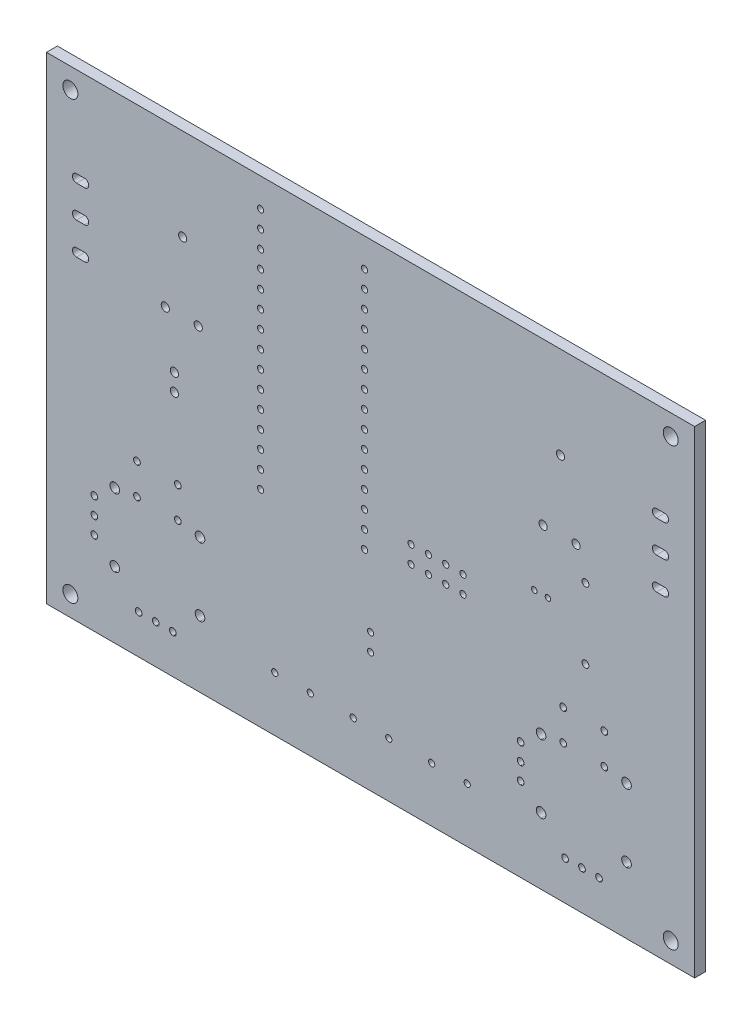
from build123d import *

# Parameters (mm, degrees)
SKETCH1_W           = 95.0000132
SKETCH1_H           = 70.0000124
SKETCH1_R           = 0.4572
SKETCH1_R_2         = 0.5999988
SKETCH1_R_3         = 0.499999
SKETCH1_R_4         = 0.4500118
SKETCH1_R_5         = 0.3999992
SKETCH1_R_6         = 1.0999978
BOSS_EXTRUDE1_DEPTH = 0.8
CUT_EXTRUDE1_START  = -1.6
CUT_EXTRUDE1_DEPTH  = 1.6


# Read off the part's stored shape, not the designer's step: Cut-Extrude1
with BuildPart() as part:
    # Sketch1 → Boss-Extrude1 (new, symmetric)
    with BuildSketch(Plane.XY):
        with Locations((47.5000066, 35.0000062)):
            Rectangle(SKETCH1_W, SKETCH1_H)
        with Locations((31.3800236, 60.7000056)):
            Circle(SKETCH1_R, mode=Mode.SUBTRACT)
        with Locations((31.3800236, 58.1600056)):
            Circle(SKETCH1_R, mode=Mode.SUBTRACT)
        with Locations((17.4200058, 46.3799936)):
            Circle(SKETCH1_R_2, mode=Mode.SUBTRACT)
        with Locations((19.9600058, 56.5399936)):
            Circle(SKETCH1_R_2, mode=Mode.SUBTRACT)
        with Locations((22.2460058, 46.3799936)):
            Circle(SKETCH1_R_2, mode=Mode.SUBTRACT)
        with Locations((79.00035, 42.150411)):
            Circle(SKETCH1_R_3, mode=Mode.SUBTRACT)
        with Locations((79.00035, 31.8504062)):
            Circle(SKETCH1_R_3, mode=Mode.SUBTRACT)
        with Locations((72.795003, 46.3799936)):
            Circle(SKETCH1_R_2, mode=Mode.SUBTRACT)
        with Locations((75.335003, 56.5399936)):
            Circle(SKETCH1_R_2, mode=Mode.SUBTRACT)
        with Locations((77.621003, 46.3799936)):
            Circle(SKETCH1_R_2, mode=Mode.SUBTRACT)
        with Locations((47.4980254, 20.142962)):
            Circle(SKETCH1_R_4, mode=Mode.SUBTRACT)
        with Locations((47.4980254, 17.602962)):
            Circle(SKETCH1_R_4, mode=Mode.SUBTRACT)
        with Locations((18.7500006, 36.2300012)):
            Circle(SKETCH1_R_2, mode=Mode.SUBTRACT)
        with Locations((33.4600042, 8.0000094)):
            Circle(SKETCH1_R, mode=Mode.SUBTRACT)
        with Locations((38.6670042, 8.0000094)):
            Circle(SKETCH1_R, mode=Mode.SUBTRACT)
        with Locations((44.9599558, 8.0000094)):
            Circle(SKETCH1_R, mode=Mode.SUBTRACT)
        with Locations((50.1669558, 8.0000094)):
            Circle(SKETCH1_R, mode=Mode.SUBTRACT)
        with Locations((56.460009, 8.0000094)):
            Circle(SKETCH1_R, mode=Mode.SUBTRACT)
        with Locations((61.667009, 8.0000094)):
            Circle(SKETCH1_R, mode=Mode.SUBTRACT)
        with Locations((71.5000094, 37.5000012)):
            Circle(SKETCH1_R_5, mode=Mode.SUBTRACT)
        with Locations((73.5000054, 37.5000012)):
            Circle(SKETCH1_R_5, mode=Mode.SUBTRACT)
        with Locations((46.6200236, 30.2200056)):
            Circle(SKETCH1_R, mode=Mode.SUBTRACT)
        with Locations((46.6200236, 32.7600056)):
            Circle(SKETCH1_R, mode=Mode.SUBTRACT)
        with Locations((46.6200236, 35.3000056)):
            Circle(SKETCH1_R, mode=Mode.SUBTRACT)
        with Locations((46.6200236, 37.8400056)):
            Circle(SKETCH1_R, mode=Mode.SUBTRACT)
        with Locations((46.6200236, 40.3800056)):
            Circle(SKETCH1_R, mode=Mode.SUBTRACT)
        with Locations((46.6200236, 42.9200056)):
            Circle(SKETCH1_R, mode=Mode.SUBTRACT)
        with Locations((46.6200236, 45.4600056)):
            Circle(SKETCH1_R, mode=Mode.SUBTRACT)
        with Locations((46.6200236, 48.0000056)):
            Circle(SKETCH1_R, mode=Mode.SUBTRACT)
        with Locations((46.6200236, 50.5400056)):
            Circle(SKETCH1_R, mode=Mode.SUBTRACT)
        with Locations((46.6200236, 53.0800056)):
            Circle(SKETCH1_R, mode=Mode.SUBTRACT)
        with Locations((46.6200236, 55.6200056)):
            Circle(SKETCH1_R, mode=Mode.SUBTRACT)
        with Locations((46.6200236, 58.1600056)):
            Circle(SKETCH1_R, mode=Mode.SUBTRACT)
        with Locations((46.6200236, 60.7000056)):
            Circle(SKETCH1_R, mode=Mode.SUBTRACT)
        with Locations((46.6200236, 63.2400056)):
            Circle(SKETCH1_R, mode=Mode.SUBTRACT)
        with Locations((46.6200236, 65.7800056)):
            Circle(SKETCH1_R, mode=Mode.SUBTRACT)
        with Locations((31.3800236, 65.7800056)):
            Circle(SKETCH1_R, mode=Mode.SUBTRACT)
        with Locations((31.3800236, 63.2400056)):
            Circle(SKETCH1_R, mode=Mode.SUBTRACT)
        with Locations((31.3800236, 55.6200056)):
            Circle(SKETCH1_R, mode=Mode.SUBTRACT)
        with Locations((31.3800236, 53.0800056)):
            Circle(SKETCH1_R, mode=Mode.SUBTRACT)
        with Locations((31.3800236, 50.5400056)):
            Circle(SKETCH1_R, mode=Mode.SUBTRACT)
        with Locations((31.3800236, 48.0000056)):
            Circle(SKETCH1_R, mode=Mode.SUBTRACT)
        with Locations((31.3800236, 45.4600056)):
            Circle(SKETCH1_R, mode=Mode.SUBTRACT)
        with Locations((31.3800236, 42.9200056)):
            Circle(SKETCH1_R, mode=Mode.SUBTRACT)
        with Locations((31.3800236, 40.3800056)):
            Circle(SKETCH1_R, mode=Mode.SUBTRACT)
        with Locations((31.3800236, 37.8400056)):
            Circle(SKETCH1_R, mode=Mode.SUBTRACT)
        with Locations((31.3800236, 35.3000056)):
            Circle(SKETCH1_R, mode=Mode.SUBTRACT)
        with Locations((31.3800236, 32.7600056)):
            Circle(SKETCH1_R, mode=Mode.SUBTRACT)
        with Locations((31.3800236, 30.2200056)):
            Circle(SKETCH1_R, mode=Mode.SUBTRACT)
        with Locations((55.9799998, 31.7300102)):
            Circle(SKETCH1_R, mode=Mode.SUBTRACT)
        with Locations((58.5199998, 31.7300102)):
            Circle(SKETCH1_R, mode=Mode.SUBTRACT)
        with Locations((61.0599998, 31.7300102)):
            Circle(SKETCH1_R, mode=Mode.SUBTRACT)
        with Locations((61.0599998, 34.2700102)):
            Circle(SKETCH1_R, mode=Mode.SUBTRACT)
        with Locations((58.5199998, 34.2700102)):
            Circle(SKETCH1_R, mode=Mode.SUBTRACT)
        with Locations((55.9799998, 34.2700102)):
            Circle(SKETCH1_R, mode=Mode.SUBTRACT)
        with Locations((53.4399998, 34.2700102)):
            Circle(SKETCH1_R, mode=Mode.SUBTRACT)
        with Locations((18.7500006, 38.7700012)):
            Circle(SKETCH1_R_2, mode=Mode.SUBTRACT)
        with Locations((53.4399998, 31.7300102)):
            Circle(SKETCH1_R, mode=Mode.SUBTRACT)
        with Locations((3.50012, 2.9999686)):
            Circle(SKETCH1_R_6, mode=Mode.SUBTRACT)
        with Locations((91.499944, 2.9999686)):
            Circle(SKETCH1_R_6, mode=Mode.SUBTRACT)
        with Locations((91.499944, 66.9998406)):
            Circle(SKETCH1_R_6, mode=Mode.SUBTRACT)
        with Locations((3.50012, 66.9998406)):
            Circle(SKETCH1_R_6, mode=Mode.SUBTRACT)
        with BuildLine():
            Line((5.6000142, 56.799988), (4.4000166, 56.799988))
            ThreePointArc((4.4000166, 56.799988), (3.8000178, 56.1999892), (4.4000166, 55.5999904))
            Line((4.4000166, 55.5999904), (5.6000142, 55.5999904))
            ThreePointArc((5.6000142, 55.5999904), (6.200013, 56.1999892), (5.6000142, 56.799988))
        make_face(mode=Mode.SUBTRACT)
        with BuildLine():
            Line((5.6000142, 52.0999974), (4.4000166, 52.0999974))
            ThreePointArc((4.4000166, 52.0999974), (3.8000178, 51.4999986), (4.4000166, 50.8999998))
            Line((4.4000166, 50.8999998), (5.6000142, 50.8999998))
            ThreePointArc((5.6000142, 50.8999998), (6.200013, 51.4999986), (5.6000142, 52.0999974))
        make_face(mode=Mode.SUBTRACT)
        with BuildLine():
            Line((5.6000142, 47.4000068), (4.4000166, 47.4000068))
            ThreePointArc((4.4000166, 47.4000068), (3.8000178, 46.800008), (4.4000166, 46.2000092))
            Line((4.4000166, 46.2000092), (5.6000142, 46.2000092))
            ThreePointArc((5.6000142, 46.2000092), (6.200013, 46.800008), (5.6000142, 47.4000068))
        make_face(mode=Mode.SUBTRACT)
        with BuildLine():
            Line((90.600022, 56.799988), (89.4000244, 56.799988))
            ThreePointArc((89.4000244, 56.799988), (88.8000256, 56.1999892), (89.4000244, 55.5999904))
            Line((89.4000244, 55.5999904), (90.600022, 55.5999904))
            ThreePointArc((90.600022, 55.5999904), (91.2000208, 56.1999892), (90.600022, 56.799988))
        make_face(mode=Mode.SUBTRACT)
        with BuildLine():
            Line((90.600022, 52.0999974), (89.4000244, 52.0999974))
            ThreePointArc((89.4000244, 52.0999974), (88.8000256, 51.4999986), (89.4000244, 50.8999998))
            Line((89.4000244, 50.8999998), (90.600022, 50.8999998))
            ThreePointArc((90.600022, 50.8999998), (91.2000208, 51.4999986), (90.600022, 52.0999974))
        make_face(mode=Mode.SUBTRACT)
        with BuildLine():
            Line((90.600022, 47.4000068), (89.4000244, 47.4000068))
            ThreePointArc((89.4000244, 47.4000068), (88.8000256, 46.800008), (89.4000244, 46.2000092))
            Line((89.4000244, 46.2000092), (90.600022, 46.2000092))
            ThreePointArc((90.600022, 46.2000092), (91.2000208, 46.800008), (90.600022, 47.4000068))
        make_face(mode=Mode.SUBTRACT)
    extrude(amount=BOSS_EXTRUDE1_DEPTH, both=True)

    # Cut-Extrude1 outline → Cut-Extrude1 (cut)
    with BuildSketch(Plane.XY.offset(0.8).offset(CUT_EXTRUDE1_START)):
        with BuildLine():
            add(Edge.make_bspline(
                [(10.018886736, 20.42583118), (10.40855395, 20.42583118), (10.724442291, 20.109948222), (10.724442291, 19.330603027), (10.40855395, 19.014720069), (10.018886736, 19.014720069)],
                knots=[0, 0, 0, 0, 1, 1, 2, 2, 2, 2], degree=3))
            add(Edge.make_bspline(
                [(10.018886736, 19.014720069), (9.629214138, 19.014720069), (9.31333118, 19.330603027), (9.31333118, 20.109948222), (9.629214138, 20.42583118), (10.018886736, 20.42583118)],
                knots=[2, 2, 2, 2, 3, 3, 4, 4, 4, 4], degree=3))
        make_face()
        with BuildLine():
            add(Edge.make_bspline(
                [(85.019444444, 10.442213609), (85.409111659, 10.442213609), (85.725, 10.126330651), (85.725, 9.346985457), (85.409111659, 9.031102498), (85.019444444, 9.031102498)],
                knots=[0, 0, 0, 0, 1, 1, 2, 2, 2, 2], degree=3))
            add(Edge.make_bspline(
                [(85.019444444, 9.031102498), (84.62977723, 9.031102498), (84.313888889, 9.346985457), (84.313888889, 10.126330651), (84.62977723, 10.442213609), (85.019444444, 10.442213609)],
                knots=[2, 2, 2, 2, 3, 3, 4, 4, 4, 4], degree=3))
        make_face()
        with BuildLine():
            add(Edge.make_bspline(
                [(85.019444444, 20.42583118), (85.409111659, 20.42583118), (85.725, 20.109948222), (85.725, 19.330603027), (85.409111659, 19.014720069), (85.019444444, 19.014720069)],
                knots=[0, 0, 0, 0, 1, 1, 2, 2, 2, 2], degree=3))
            add(Edge.make_bspline(
                [(85.019444444, 19.014720069), (84.62977723, 19.014720069), (84.313888889, 19.330603027), (84.313888889, 20.109948222), (84.62977723, 20.42583118), (85.019444444, 20.42583118)],
                knots=[2, 2, 2, 2, 3, 3, 4, 4, 4, 4], degree=3))
        make_face()
        with BuildLine():
            add(Edge.make_bspline(
                [(81.77388862, 20.708049096), (82.046655401, 20.708049096), (82.267778047, 20.486927795), (82.267778047, 19.941396925), (82.046655401, 19.720275625), (81.77388862, 19.720275625)],
                knots=[0, 0, 0, 0, 1, 1, 2, 2, 2, 2], degree=3))
            add(Edge.make_bspline(
                [(81.77388862, 19.720275625), (81.501121839, 19.720275625), (81.279999193, 19.941396925), (81.279999193, 20.486927795), (81.501121839, 20.708049096), (81.77388862, 20.708049096)],
                knots=[2, 2, 2, 2, 3, 3, 4, 4, 4, 4], degree=3))
        make_face()
        with BuildLine():
            add(Edge.make_bspline(
                [(75.741387812, 20.708049096), (76.014155939, 20.708049096), (76.235277239, 20.486927795), (76.235277239, 19.941396925), (76.014155939, 19.720275625), (75.741387812, 19.720275625)],
                knots=[0, 0, 0, 0, 1, 1, 2, 2, 2, 2], degree=3))
            add(Edge.make_bspline(
                [(75.741387812, 19.720275625), (75.468619686, 19.720275625), (75.247498385, 19.941396925), (75.247498385, 20.486927795), (75.468619686, 20.708049096), (75.741387812, 20.708049096)],
                knots=[2, 2, 2, 2, 3, 3, 4, 4, 4, 4], degree=3))
        make_face()
        with BuildLine():
            add(Edge.make_bspline(
                [(72.495833333, 20.42583118), (72.885500548, 20.42583118), (73.201388889, 20.109948222), (73.201388889, 19.330603027), (72.885500548, 19.014720069), (72.495833333, 19.014720069)],
                knots=[0, 0, 0, 0, 1, 1, 2, 2, 2, 2], degree=3))
            add(Edge.make_bspline(
                [(72.495833333, 19.014720069), (72.106166119, 19.014720069), (71.790277778, 19.330603027), (71.790277778, 20.109948222), (72.106166119, 20.42583118), (72.495833333, 20.42583118)],
                knots=[2, 2, 2, 2, 3, 3, 4, 4, 4, 4], degree=3))
        make_face()
        with BuildLine():
            add(Edge.make_bspline(
                [(69.497222222, 17.709437985), (69.769990349, 17.709437985), (69.991111649, 17.488316684), (69.991111649, 16.942785814), (69.769990349, 16.721664513), (69.497222222, 16.721664513)],
                knots=[0, 0, 0, 0, 1, 1, 2, 2, 2, 2], degree=3))
            add(Edge.make_bspline(
                [(69.497222222, 16.721664513), (69.224454096, 16.721664513), (69.003332795, 16.942785814), (69.003332795, 17.488316684), (69.224454096, 17.709437985), (69.497222222, 17.709437985)],
                knots=[2, 2, 2, 2, 3, 3, 4, 4, 4, 4], degree=3))
        make_face()
        with BuildLine():
            add(Edge.make_bspline(
                [(69.497222222, 15.204713609), (69.769990349, 15.204713609), (69.991111649, 14.983592309), (69.991111649, 14.438061439), (69.769990349, 14.216940138), (69.497222222, 14.216940138)],
                knots=[0, 0, 0, 0, 1, 1, 2, 2, 2, 2], degree=3))
            add(Edge.make_bspline(
                [(69.497222222, 14.216940138), (69.224454096, 14.216940138), (69.003332795, 14.438061439), (69.003332795, 14.983592309), (69.224454096, 15.204713609), (69.497222222, 15.204713609)],
                knots=[2, 2, 2, 2, 3, 3, 4, 4, 4, 4], degree=3))
        make_face()
        with BuildLine():
            add(Edge.make_bspline(
                [(69.497222222, 12.735269165), (69.769990349, 12.735269165), (69.991111649, 12.514147864), (69.991111649, 11.968616994), (69.769990349, 11.747495694), (69.497222222, 11.747495694)],
                knots=[0, 0, 0, 0, 1, 1, 2, 2, 2, 2], degree=3))
            add(Edge.make_bspline(
                [(69.497222222, 11.747495694), (69.224454096, 11.747495694), (69.003332795, 11.968616994), (69.003332795, 12.514147864), (69.224454096, 12.735269165), (69.497222222, 12.735269165)],
                knots=[2, 2, 2, 2, 3, 3, 4, 4, 4, 4], degree=3))
        make_face()
        with BuildLine():
            add(Edge.make_bspline(
                [(72.495833333, 10.442213609), (72.885500548, 10.442213609), (73.201388889, 10.126330651), (73.201388889, 9.346985457), (72.885500548, 9.031102498), (72.495833333, 9.031102498)],
                knots=[0, 0, 0, 0, 1, 1, 2, 2, 2, 2], degree=3))
            add(Edge.make_bspline(
                [(72.495833333, 9.031102498), (72.106166119, 9.031102498), (71.790277778, 9.346985457), (71.790277778, 10.126330651), (72.106166119, 10.442213609), (72.495833333, 10.442213609)],
                knots=[2, 2, 2, 2, 3, 3, 4, 4, 4, 4], degree=3))
        make_face()
        with BuildLine():
            add(Edge.make_bspline(
                [(75.741387812, 25.223600345), (76.014155939, 25.223600345), (76.235277239, 25.002479045), (76.235277239, 24.456948174), (76.014155939, 24.235826874), (75.741387812, 24.235826874)],
                knots=[0, 0, 0, 0, 1, 1, 2, 2, 2, 2], degree=3))
            add(Edge.make_bspline(
                [(75.741387812, 24.235826874), (75.468619686, 24.235826874), (75.247498385, 24.456948174), (75.247498385, 25.002479045), (75.468619686, 25.223600345), (75.741387812, 25.223600345)],
                knots=[2, 2, 2, 2, 3, 3, 4, 4, 4, 4], degree=3))
        make_face()
        with BuildLine():
            add(Edge.make_bspline(
                [(81.77388862, 25.223600345), (82.046655401, 25.223600345), (82.267778047, 25.002479045), (82.267778047, 24.456948174), (82.046655401, 24.235826874), (81.77388862, 24.235826874)],
                knots=[0, 0, 0, 0, 1, 1, 2, 2, 2, 2], degree=3))
            add(Edge.make_bspline(
                [(81.77388862, 24.235826874), (81.501121839, 24.235826874), (81.279999193, 24.456948174), (81.279999193, 25.002479045), (81.501121839, 25.223600345), (81.77388862, 25.223600345)],
                knots=[2, 2, 2, 2, 3, 3, 4, 4, 4, 4], degree=3))
        make_face()
        with BuildLine():
            add(Edge.make_bspline(
                [(22.507223299, 10.442213609), (22.896890513, 10.442213609), (23.212778854, 10.126330651), (23.212778854, 9.346985457), (22.896890513, 9.031102498), (22.507223299, 9.031102498)],
                knots=[0, 0, 0, 0, 1, 1, 2, 2, 2, 2], degree=3))
            add(Edge.make_bspline(
                [(22.507223299, 9.031102498), (22.117556085, 9.031102498), (21.801667743, 9.346985457), (21.801667743, 10.126330651), (22.117556085, 10.442213609), (22.507223299, 10.442213609)],
                knots=[2, 2, 2, 2, 3, 3, 4, 4, 4, 4], degree=3))
        make_face()
        with BuildLine():
            add(Edge.make_bspline(
                [(80.997777239, 6.208880276), (81.27054402, 6.208880276), (81.491666667, 5.987758976), (81.491666667, 5.442228105), (81.27054402, 5.221106805), (80.997777239, 5.221106805)],
                knots=[0, 0, 0, 0, 1, 1, 2, 2, 2, 2], degree=3))
            add(Edge.make_bspline(
                [(80.997777239, 5.221106805), (80.725010459, 5.221106805), (80.503887812, 5.442228105), (80.503887812, 5.987758976), (80.725010459, 6.208880276), (80.997777239, 6.208880276)],
                knots=[2, 2, 2, 2, 3, 3, 4, 4, 4, 4], degree=3))
        make_face()
        with BuildLine():
            add(Edge.make_bspline(
                [(78.493055556, 6.208880276), (78.765822336, 6.208880276), (78.986944983, 5.987758976), (78.986944983, 5.442228105), (78.765822336, 5.221106805), (78.493055556, 5.221106805)],
                knots=[0, 0, 0, 0, 1, 1, 2, 2, 2, 2], degree=3))
            add(Edge.make_bspline(
                [(78.493055556, 5.221106805), (78.220288775, 5.221106805), (77.999166128, 5.442228105), (77.999166128, 5.987758976), (78.220288775, 6.208880276), (78.493055556, 6.208880276)],
                knots=[2, 2, 2, 2, 3, 3, 4, 4, 4, 4], degree=3))
        make_face()
        with BuildLine():
            add(Edge.make_bspline(
                [(76.023611111, 6.208880276), (76.296379238, 6.208880276), (76.517500538, 5.987758976), (76.517500538, 5.442228105), (76.296379238, 5.221106805), (76.023611111, 5.221106805)],
                knots=[0, 0, 0, 0, 1, 1, 2, 2, 2, 2], degree=3))
            add(Edge.make_bspline(
                [(76.023611111, 5.221106805), (75.750842985, 5.221106805), (75.529721684, 5.442228105), (75.529721684, 5.987758976), (75.750842985, 6.208880276), (76.023611111, 6.208880276)],
                knots=[2, 2, 2, 2, 3, 3, 4, 4, 4, 4], degree=3))
        make_face()
        with BuildLine():
            add(Edge.make_bspline(
                [(18.520833333, 6.208880276), (18.793598768, 6.208880276), (19.014720069, 5.987758976), (19.014720069, 5.442228105), (18.793598768, 5.221106805), (18.520833333, 5.221106805)],
                knots=[0, 0, 0, 0, 1, 1, 2, 2, 2, 2], degree=3))
            add(Edge.make_bspline(
                [(18.520833333, 5.221106805), (18.248067898, 5.221106805), (18.026946598, 5.442228105), (18.026946598, 5.987758976), (18.248067898, 6.208880276), (18.520833333, 6.208880276)],
                knots=[2, 2, 2, 2, 3, 3, 4, 4, 4, 4], degree=3))
        make_face()
        with BuildLine():
            add(Edge.make_bspline(
                [(16.016108958, 6.208880276), (16.288874393, 6.208880276), (16.509995694, 5.987758976), (16.509995694, 5.442228105), (16.288874393, 5.221106805), (16.016108958, 5.221106805)],
                knots=[0, 0, 0, 0, 1, 1, 2, 2, 2, 2], degree=3))
            add(Edge.make_bspline(
                [(16.016108958, 5.221106805), (15.743343523, 5.221106805), (15.522222222, 5.442228105), (15.522222222, 5.987758976), (15.743343523, 6.208880276), (16.016108958, 6.208880276)],
                knots=[2, 2, 2, 2, 3, 3, 4, 4, 4, 4], degree=3))
        make_face()
        with BuildLine():
            add(Edge.make_bspline(
                [(13.511389965, 6.208880276), (13.784155401, 6.208880276), (14.005276701, 5.987758976), (14.005276701, 5.442228105), (13.784155401, 5.221106805), (13.511389965, 5.221106805)],
                knots=[0, 0, 0, 0, 1, 1, 2, 2, 2, 2], degree=3))
            add(Edge.make_bspline(
                [(13.511389965, 5.221106805), (13.23862453, 5.221106805), (13.01750323, 5.442228105), (13.01750323, 5.987758976), (13.23862453, 6.208880276), (13.511389965, 6.208880276)],
                knots=[2, 2, 2, 2, 3, 3, 4, 4, 4, 4], degree=3))
        make_face()
        with BuildLine():
            add(Edge.make_bspline(
                [(10.018886736, 10.442213609), (10.40855395, 10.442213609), (10.724442291, 10.126330651), (10.724442291, 9.346985457), (10.40855395, 9.031102498), (10.018886736, 9.031102498)],
                knots=[0, 0, 0, 0, 1, 1, 2, 2, 2, 2], degree=3))
            add(Edge.make_bspline(
                [(10.018886736, 9.031102498), (9.629214138, 9.031102498), (9.31333118, 9.346985457), (9.31333118, 10.126330651), (9.629214138, 10.442213609), (10.018886736, 10.442213609)],
                knots=[2, 2, 2, 2, 3, 3, 4, 4, 4, 4], degree=3))
        make_face()
        with BuildLine():
            add(Edge.make_bspline(
                [(13.264446598, 20.708049096), (13.537212033, 20.708049096), (13.758333333, 20.486927795), (13.758333333, 19.941396925), (13.537212033, 19.720275625), (13.264446598, 19.720275625)],
                knots=[0, 0, 0, 0, 1, 1, 2, 2, 2, 2], degree=3))
            add(Edge.make_bspline(
                [(13.264446598, 19.720275625), (12.991681163, 19.720275625), (12.770559862, 19.941396925), (12.770559862, 20.486927795), (12.991681163, 20.708049096), (13.264446598, 20.708049096)],
                knots=[2, 2, 2, 2, 3, 3, 4, 4, 4, 4], degree=3))
        make_face()
        with BuildLine():
            add(Edge.make_bspline(
                [(13.264446598, 25.223600345), (13.537212033, 25.223600345), (13.758333333, 25.002479045), (13.758333333, 24.456948174), (13.537212033, 24.235826874), (13.264446598, 24.235826874)],
                knots=[0, 0, 0, 0, 1, 1, 2, 2, 2, 2], degree=3))
            add(Edge.make_bspline(
                [(13.264446598, 24.235826874), (12.991681163, 24.235826874), (12.770559862, 24.456948174), (12.770559862, 25.002479045), (12.991681163, 25.223600345), (13.264446598, 25.223600345)],
                knots=[2, 2, 2, 2, 3, 3, 4, 4, 4, 4], degree=3))
        make_face()
        with BuildLine():
            add(Edge.make_bspline(
                [(19.26166882, 25.223600345), (19.534434255, 25.223600345), (19.755555556, 25.002479045), (19.755555556, 24.456948174), (19.534434255, 24.235826874), (19.26166882, 24.235826874)],
                knots=[0, 0, 0, 0, 1, 1, 2, 2, 2, 2], degree=3))
            add(Edge.make_bspline(
                [(19.26166882, 24.235826874), (18.988903385, 24.235826874), (18.767782084, 24.456948174), (18.767782084, 25.002479045), (18.988903385, 25.223600345), (19.26166882, 25.223600345)],
                knots=[2, 2, 2, 2, 3, 3, 4, 4, 4, 4], degree=3))
        make_face()
        with BuildLine():
            add(Edge.make_bspline(
                [(19.26166882, 20.708049096), (19.534434255, 20.708049096), (19.755555556, 20.486927795), (19.755555556, 19.941396925), (19.534434255, 19.720275625), (19.26166882, 19.720275625)],
                knots=[0, 0, 0, 0, 1, 1, 2, 2, 2, 2], degree=3))
            add(Edge.make_bspline(
                [(19.26166882, 19.720275625), (18.988903385, 19.720275625), (18.767782084, 19.941396925), (18.767782084, 20.486927795), (18.988903385, 20.708049096), (19.26166882, 20.708049096)],
                knots=[2, 2, 2, 2, 3, 3, 4, 4, 4, 4], degree=3))
        make_face()
        with BuildLine():
            add(Edge.make_bspline(
                [(22.507223299, 20.42583118), (22.896890513, 20.42583118), (23.212778854, 20.109948222), (23.212778854, 19.330603027), (22.896890513, 19.014720069), (22.507223299, 19.014720069)],
                knots=[0, 0, 0, 0, 1, 1, 2, 2, 2, 2], degree=3))
            add(Edge.make_bspline(
                [(22.507223299, 19.014720069), (22.117556085, 19.014720069), (21.801667743, 19.330603027), (21.801667743, 20.109948222), (22.117556085, 20.42583118), (22.507223299, 20.42583118)],
                knots=[2, 2, 2, 2, 3, 3, 4, 4, 4, 4], degree=3))
        make_face()
        with BuildLine():
            add(Edge.make_bspline(
                [(7.020275625, 17.709437985), (7.29304106, 17.709437985), (7.51416236, 17.488316684), (7.51416236, 16.942785814), (7.29304106, 16.721664513), (7.020275625, 16.721664513)],
                knots=[0, 0, 0, 0, 1, 1, 2, 2, 2, 2], degree=3))
            add(Edge.make_bspline(
                [(7.020275625, 16.721664513), (6.747510189, 16.721664513), (6.526388889, 16.942785814), (6.526388889, 17.488316684), (6.747510189, 17.709437985), (7.020275625, 17.709437985)],
                knots=[2, 2, 2, 2, 3, 3, 4, 4, 4, 4], degree=3))
        make_face()
        with BuildLine():
            add(Edge.make_bspline(
                [(7.020275625, 15.204713609), (7.29304106, 15.204713609), (7.51416236, 14.983592309), (7.51416236, 14.438061439), (7.29304106, 14.216940138), (7.020275625, 14.216940138)],
                knots=[0, 0, 0, 0, 1, 1, 2, 2, 2, 2], degree=3))
            add(Edge.make_bspline(
                [(7.020275625, 14.216940138), (6.747510189, 14.216940138), (6.526388889, 14.438061439), (6.526388889, 14.983592309), (6.747510189, 15.204713609), (7.020275625, 15.204713609)],
                knots=[2, 2, 2, 2, 3, 3, 4, 4, 4, 4], degree=3))
        make_face()
        with BuildLine():
            add(Edge.make_bspline(
                [(7.020275625, 12.735269165), (7.29304106, 12.735269165), (7.51416236, 12.514147864), (7.51416236, 11.968616994), (7.29304106, 11.747495694), (7.020275625, 11.747495694)],
                knots=[0, 0, 0, 0, 1, 1, 2, 2, 2, 2], degree=3))
            add(Edge.make_bspline(
                [(7.020275625, 11.747495694), (6.747510189, 11.747495694), (6.526388889, 11.968616994), (6.526388889, 12.514147864), (6.747510189, 12.735269165), (7.020275625, 12.735269165)],
                knots=[2, 2, 2, 2, 3, 3, 4, 4, 4, 4], degree=3))
        make_face()
    extrude(amount=CUT_EXTRUDE1_DEPTH, mode=Mode.SUBTRACT)


solid = part.part
